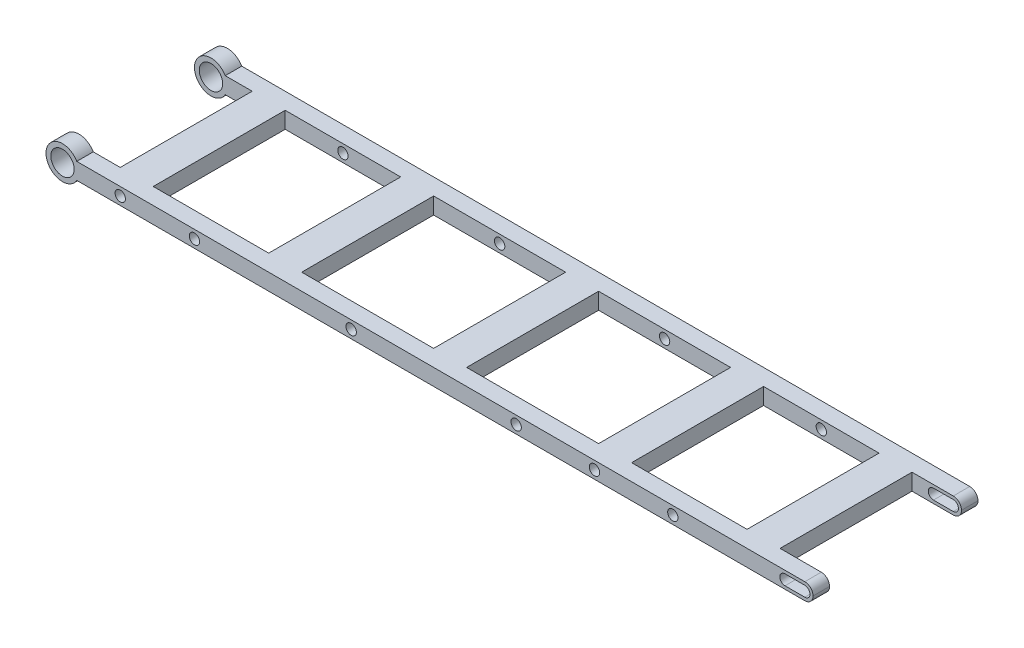
from build123d import *

# Parameters (mm, degrees)
SKETCH1_W           = 50.8
SKETCH1_H           = 50.8
SKETCH1_W_2         = 44.45
BOSS_EXTRUDE1_DEPTH = 6.35
FILLET2_R           = 3.175
SKETCH2_R           = 6.35
BOSS_EXTRUDE3_DEPTH = 6.35
BOSS_EXTRUDE4_START = -6.35
SKETCH4_R           = 6.35
BOSS_EXTRUDE4_DEPTH = 6.35
CUT_EXTRUDE1_REACH  = 164.453
SKETCH2_4_R         = 4.49961
SKETCH2_4_R_2       = 1.9939
BOSS_EXTRUDE5_DEPTH = 127


with BuildPart() as part:
    # Sketch1 → Boss-Extrude1 (new body)
    with BuildSketch(Plane(origin=(0, 0, 0), x_dir=(1, 0, 0), z_dir=(0, 1, 0))):
        Polygon((-146.05, 25.4), (-127, 25.4), (-127, -25.4), (-146.05, -25.4), (-146.05, -31.75), (146.05, -31.75), (146.05, -25.4), (127, -25.4), (127, 25.4), (146.05, 25.4), (146.05, 31.75), (-146.05, 31.75), align=None)
        with Locations((-31.75, 0)):
            Rectangle(SKETCH1_W, SKETCH1_H, mode=Mode.SUBTRACT)
        with Locations((-92.075, 0)):
            Rectangle(SKETCH1_W_2, SKETCH1_H, mode=Mode.SUBTRACT)
        with Locations((31.75, 0)):
            Rectangle(SKETCH1_W, SKETCH1_H, mode=Mode.SUBTRACT)
        with Locations((92.075, 0)):
            Rectangle(SKETCH1_W_2, SKETCH1_H, mode=Mode.SUBTRACT)
    extrude(amount=-BOSS_EXTRUDE1_DEPTH)

    # Fillet2
    fillet2_edges = [part.edges().sort_by_distance(p)[0] for p in [
        (-146.05, -6.35, 28.575),
        (-146.05, 0, 28.575),
        (-146.05, -6.35, -28.575),
        (-146.05, 0, -28.575),
        (146.05, -6.35, -28.575),
        (146.05, 0, -28.575),
        (146.05, -6.35, 28.575),
        (146.05, 0, 28.575),
    ]]
    fillet(fillet2_edges, radius=FILLET2_R - 0.0001)  # a hair under: the kernel refuses the full size

    # Sketch2 → Boss-Extrude3 (add)
    with BuildSketch(Plane.XY.offset(31.75)):
        with Locations((-142.875, -3.175)):
            Circle(SKETCH2_R)
    extrude(amount=-BOSS_EXTRUDE3_DEPTH)

    # Sketch4 → Boss-Extrude4 (add)
    with BuildSketch(Plane(origin=(0, 0, -31.75), x_dir=(-1, 0, 0), z_dir=(0, 0, -1)).offset(BOSS_EXTRUDE4_START)):
        with Locations((142.875, -3.175)):
            Circle(SKETCH4_R)
    extrude(amount=BOSS_EXTRUDE4_DEPTH)

    # Cut-Extrude1: up to this face of the body (flat: up to its plane)
    cut_extrude1_end = Plane(part.part.faces().sort_by_distance((-5.43222234, -3.175, -31.75))[0])
    # Sketch2<4> → Cut-Extrude1 (cut, up to the picked face)
    with BuildSketch(Plane.XY.offset(31.75), mode=Mode.PRIVATE) as cut_extrude1_sk1:
        with Locations((-142.875, -3.175)):
            Circle(SKETCH2_4_R)
    cut_extrude1_tool1 = split(extrude(cut_extrude1_sk1.sketch, amount=-CUT_EXTRUDE1_REACH, mode=Mode.PRIVATE), bisect_by=cut_extrude1_end, keep=Keep.BOTH, mode=Mode.PRIVATE)
    # Sketch2<4> → Cut-Extrude1 (cut, up to the picked face)
    with BuildSketch(Plane.XY.offset(31.75), mode=Mode.PRIVATE) as cut_extrude1_sk2:
        with Locations((-92.075, -3.175)):
            Circle(SKETCH2_4_R_2)
    cut_extrude1_tool2 = split(extrude(cut_extrude1_sk2.sketch, amount=-CUT_EXTRUDE1_REACH, mode=Mode.PRIVATE), bisect_by=cut_extrude1_end, keep=Keep.BOTH, mode=Mode.PRIVATE)
    # Sketch2<4> → Cut-Extrude1 (cut, up to the picked face)
    with BuildSketch(Plane.XY.offset(31.75), mode=Mode.PRIVATE) as cut_extrude1_sk3:
        with Locations((-31.75, -3.175)):
            Circle(SKETCH2_4_R_2)
    cut_extrude1_tool3 = split(extrude(cut_extrude1_sk3.sketch, amount=-CUT_EXTRUDE1_REACH, mode=Mode.PRIVATE), bisect_by=cut_extrude1_end, keep=Keep.BOTH, mode=Mode.PRIVATE)
    # Sketch2<4> → Cut-Extrude1 (cut, up to the picked face)
    with BuildSketch(Plane.XY.offset(31.75), mode=Mode.PRIVATE) as cut_extrude1_sk4:
        with Locations((31.75, -3.175)):
            Circle(SKETCH2_4_R_2)
    cut_extrude1_tool4 = split(extrude(cut_extrude1_sk4.sketch, amount=-CUT_EXTRUDE1_REACH, mode=Mode.PRIVATE), bisect_by=cut_extrude1_end, keep=Keep.BOTH, mode=Mode.PRIVATE)
    # Sketch2<4> → Cut-Extrude1 (cut, up to the picked face)
    with BuildSketch(Plane.XY.offset(31.75), mode=Mode.PRIVATE) as cut_extrude1_sk5:
        with Locations((92.075, -3.175)):
            Circle(SKETCH2_4_R_2)
    cut_extrude1_tool5 = split(extrude(cut_extrude1_sk5.sketch, amount=-CUT_EXTRUDE1_REACH, mode=Mode.PRIVATE), bisect_by=cut_extrude1_end, keep=Keep.BOTH, mode=Mode.PRIVATE)
    # Sketch2<4> → Cut-Extrude1 (cut, up to the picked face)
    with BuildSketch(Plane.XY.offset(31.75), mode=Mode.PRIVATE) as cut_extrude1_sk6:
        with Locations((-120.65, -3.175)):
            Circle(SKETCH2_4_R_2)
    cut_extrude1_tool6 = split(extrude(cut_extrude1_sk6.sketch, amount=-CUT_EXTRUDE1_REACH, mode=Mode.PRIVATE), bisect_by=cut_extrude1_end, keep=Keep.BOTH, mode=Mode.PRIVATE)
    # Sketch2<4> → Cut-Extrude1 (cut, up to the picked face)
    with BuildSketch(Plane.XY.offset(31.75), mode=Mode.PRIVATE) as cut_extrude1_sk7:
        with Locations((61.9125, -3.175)):
            Circle(SKETCH2_4_R_2)
    cut_extrude1_tool7 = split(extrude(cut_extrude1_sk7.sketch, amount=-CUT_EXTRUDE1_REACH, mode=Mode.PRIVATE), bisect_by=cut_extrude1_end, keep=Keep.BOTH, mode=Mode.PRIVATE)
    # Sketch2<4> → Cut-Extrude1 (cut, up to the picked face)
    with BuildSketch(Plane.XY.offset(31.75), mode=Mode.PRIVATE) as cut_extrude1_sk8:
        with BuildLine():
            Line((135.255, -1.1811), (142.875, -1.1811))
            ThreePointArc((142.875, -1.1811), (144.8689, -3.175), (142.875, -5.1689))
            Line((142.875, -5.1689), (135.255, -5.1689))
            ThreePointArc((135.255, -5.1689), (133.2611, -3.175), (135.255, -1.1811))
        make_face()
    cut_extrude1_tool8 = split(extrude(cut_extrude1_sk8.sketch, amount=-CUT_EXTRUDE1_REACH, mode=Mode.PRIVATE), bisect_by=cut_extrude1_end, keep=Keep.BOTH, mode=Mode.PRIVATE)
    add(cut_extrude1_tool1.solids().sort_by(Axis((-142.875, -3.175, 31.75), (0, 0, -1)))[0], mode=Mode.SUBTRACT)
    add(cut_extrude1_tool2.solids().sort_by(Axis((-92.075, -3.175, 31.75), (0, 0, -1)))[0], mode=Mode.SUBTRACT)
    add(cut_extrude1_tool3.solids().sort_by(Axis((-31.75, -3.175, 31.75), (0, 0, -1)))[0], mode=Mode.SUBTRACT)
    add(cut_extrude1_tool4.solids().sort_by(Axis((31.75, -3.175, 31.75), (0, 0, -1)))[0], mode=Mode.SUBTRACT)
    add(cut_extrude1_tool5.solids().sort_by(Axis((92.075, -3.175, 31.75), (0, 0, -1)))[0], mode=Mode.SUBTRACT)
    add(cut_extrude1_tool6.solids().sort_by(Axis((-120.65, -3.175, 31.75), (0, 0, -1)))[0], mode=Mode.SUBTRACT)
    add(cut_extrude1_tool7.solids().sort_by(Axis((61.9125, -3.175, 31.75), (0, 0, -1)))[0], mode=Mode.SUBTRACT)
    add(cut_extrude1_tool8.solids().sort_by(Axis((139.065, -3.175, 31.75), (0, 0, -1)))[0], mode=Mode.SUBTRACT)

    # Sketch5 → Boss-Extrude5 (add)
    with BuildSketch(Plane(origin=(127, 0, 0), x_dir=(0, 0, -1), z_dir=(1, 0, 0))):
        Polygon((25.4, -6.35), (31.75, -6.35), (28.575, -9.525), align=None)
        Polygon((-31.75, -6.35), (-25.4, -6.35), (-28.575, -9.525), align=None)
    extrude(amount=-BOSS_EXTRUDE5_DEPTH)


solid = part.part
